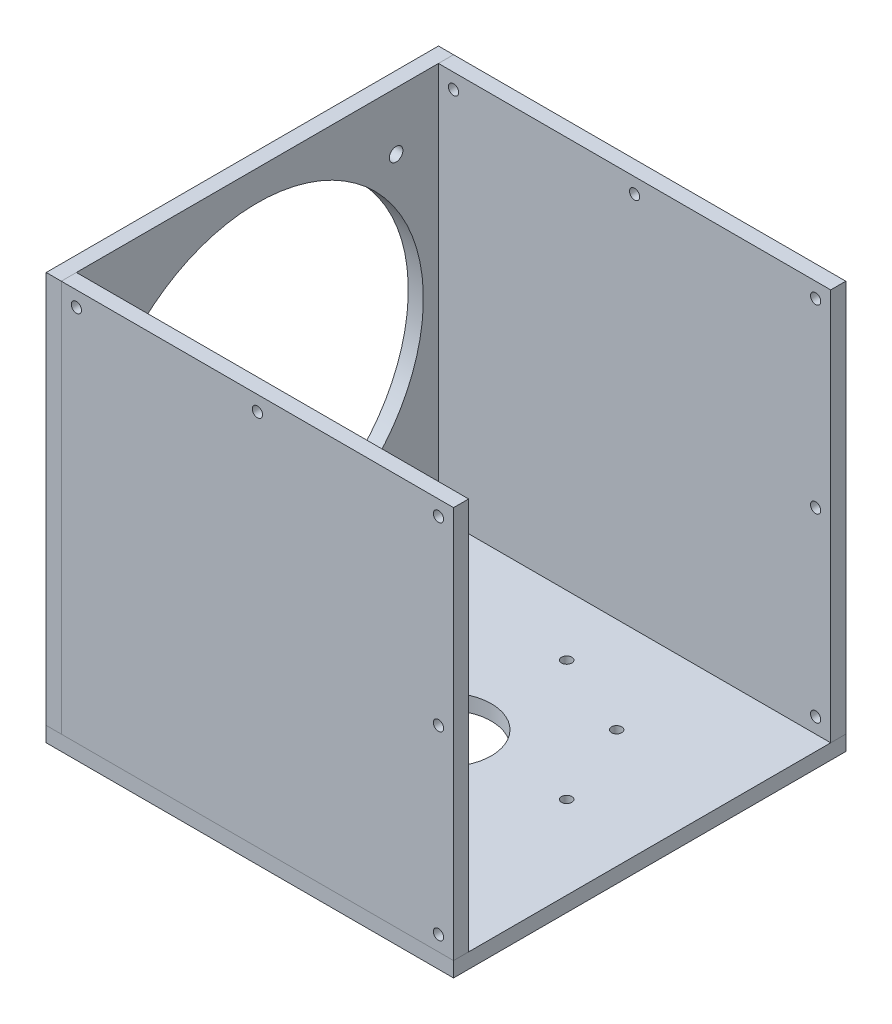
from build123d import *

# Parameters (mm, degrees)
CROQUIS1_R                            = 15
SALIENTE_EXTRUIR1_DEPTH               = 2.5
TALADRO_DE_MARGEN_PARA_M31_D          = 3.4
TALADRO_DE_MARGEN_PARA_M31_DEPTH      = 20
TALADRO_DE_MARGEN_PARA_M31_TIP        = 1.021463052
CROQUIS5_W                            = 130
CROQUIS5_H                            = 130
CROQUIS5_R                            = 55
SALIENTE_EXTRUIR2_DEPTH               = 5
TALADRO_DE_MARGEN_PARA_M41_AT_2_COUNT = 2
TALADRO_DE_MARGEN_PARA_M41_AT_2_PITCH = 130
TALADRO_DE_MARGEN_PARA_M41_AT_3_COUNT = 2
TALADRO_DE_MARGEN_PARA_M41_AT_3_PITCH = 91.923881554
TALADRO_DE_MARGEN_PARA_M41_AT_4_COUNT = 2
TALADRO_DE_MARGEN_PARA_M41_AT_4_PITCH = 91.923881554
CROQUIS9_W                            = 130
CROQUIS9_H                            = 130
SALIENTE_EXTRUIR4_DEPTH               = 5
TALADRO_START                         = 60
TALADRO_DE_MARGEN_PARA_M32_OUTLINE_R  = 1.7
TALADRO_DE_MARGEN_PARA_M32_DEPTH      = 5
MATRIZL2_COUNT                        = 2
MATRIZL2_PITCH                        = 125
TALADRO_START_2                       = -65
TALADRO_DE_MARGEN_PARA_M33_OUTLINE_R  = 1.7
TALADRO_DE_MARGEN_PARA_M33_DEPTH      = 5


# Read off the part's stored shape, not the designer's step: Taladro de margen para M32, Taladro de margen para M33
with BuildPart() as part:
    # Croquis1 → Saliente-Extruir1 (new, symmetric)
    with BuildSketch(Plane(origin=(0, 0, 0), x_dir=(1, 0, 0), z_dir=(0, 1, 0))):
        Polygon((0, 65), (-67.5, 65), (-67.5, -65), (0, -65), (67.5, -65), (67.5, 65), align=None)
        with Locations(Location((0, 0, 0), (0, 0, 270))):
            Circle(CROQUIS1_R, mode=Mode.SUBTRACT)
    extrude(amount=SALIENTE_EXTRUIR1_DEPTH, both=True)

    # Taladro de margen para M31
    with Locations(Plane(origin=(0, 2.5, 0), x_dir=(1, 0, 0), z_dir=(0, 1, 0))):
        with Locations((0, 40), (28.284271247, 28.284271247), (40, 0), (28.284271247, -28.284271247), (0, -40), (-28.284271247, -28.284271247), (-40, 0), (-28.284271247, 28.284271247)):
            Hole(TALADRO_DE_MARGEN_PARA_M31_D / 2, depth=TALADRO_DE_MARGEN_PARA_M31_DEPTH)
            with Locations((0, 0, -(TALADRO_DE_MARGEN_PARA_M31_DEPTH + TALADRO_DE_MARGEN_PARA_M31_TIP / 2))):  # 118° drill point
                Cone(0, TALADRO_DE_MARGEN_PARA_M31_D / 2, TALADRO_DE_MARGEN_PARA_M31_TIP, mode=Mode.SUBTRACT)


with BuildPart() as body_2:
    # Croquis5 → Saliente-Extruir2 (new body)
    with BuildSketch(Plane.ZY.offset(67.5)):
        with Locations((0, 67.5)):
            Rectangle(CROQUIS5_W, CROQUIS5_H)
        with Locations((0, 67.5)):
            Circle(CROQUIS5_R, mode=Mode.SUBTRACT)
    extrude(amount=-SALIENTE_EXTRUIR2_DEPTH)

    # Croquis7 → Taladro de margen para M41 (revolve, cut)
    with BuildSketch(Plane(origin=(-67.5, 113.461940777, 45.961940777), x_dir=(0, 0, 1), z_dir=(0, 1, 0))):
        Polygon((0, 0), (0, 21.351936393), (2.25, 20), (2.25, 0), align=None)
    taladro_de_margen_para_m41 = revolve(axis=Axis((-73.85, 113.461940777, 45.961940777), (1, 0, 0)), mode=Mode.SUBTRACT)

    # Taladro de margen para M41 at 2: Taladro de margen para M41 ×2
    with Locations(*[Vector(0, -0.7071067811865476, -0.7071067811865476) * (i * TALADRO_DE_MARGEN_PARA_M41_AT_2_PITCH) for i in range(1, TALADRO_DE_MARGEN_PARA_M41_AT_2_COUNT)]):
        add(taladro_de_margen_para_m41, mode=Mode.SUBTRACT)

    # Taladro de margen para M41 at 3: Taladro de margen para M41 ×2
    with Locations(*[(0, 0, -i * TALADRO_DE_MARGEN_PARA_M41_AT_3_PITCH) for i in range(1, TALADRO_DE_MARGEN_PARA_M41_AT_3_COUNT)]):
        add(taladro_de_margen_para_m41, mode=Mode.SUBTRACT)

    # Taladro de margen para M41 at 4: Taladro de margen para M41 ×2
    with Locations(*[(0, -i * TALADRO_DE_MARGEN_PARA_M41_AT_4_PITCH, 0) for i in range(1, TALADRO_DE_MARGEN_PARA_M41_AT_4_COUNT)]):
        add(taladro_de_margen_para_m41, mode=Mode.SUBTRACT)


with BuildPart() as body_3:
    # Croquis9 → Saliente-Extruir4 (new body)
    with BuildSketch(Plane.XY.offset(65)):
        with Locations((2.5, 67.5)):
            Rectangle(CROQUIS9_W, CROQUIS9_H)
    saliente_extruir4 = extrude(amount=-SALIENTE_EXTRUIR4_DEPTH)

    # Taladro de margen para M32 outline → Taladro de margen para M32 (cut)
    with BuildSketch(Plane.XY.offset(TALADRO_START)):
        with Locations((62.5, 7.5)):
            Circle(TALADRO_DE_MARGEN_PARA_M32_OUTLINE_R)
        with Locations((62.5, 67.5)):
            Circle(TALADRO_DE_MARGEN_PARA_M32_OUTLINE_R)
        with Locations((62.5, 127.5)):
            Circle(TALADRO_DE_MARGEN_PARA_M32_OUTLINE_R)
        with Locations((2.5, 127.5)):
            Circle(TALADRO_DE_MARGEN_PARA_M32_OUTLINE_R)
        with Locations((-57.5, 127.5)):
            Circle(TALADRO_DE_MARGEN_PARA_M32_OUTLINE_R)
    extrude(amount=TALADRO_DE_MARGEN_PARA_M32_DEPTH, mode=Mode.SUBTRACT)


with BuildPart() as matrizl2_1:
    # MatrizL2: Saliente-Extruir4 ×2
    with Locations(*[(0, 0, -i * MATRIZL2_PITCH) for i in range(1, MATRIZL2_COUNT)]):
        add(saliente_extruir4)

    # Taladro de margen para M33 outline → Taladro de margen para M33 (cut)
    with BuildSketch(Plane.XY.offset(TALADRO_START_2)):
        with Locations((62.5, 67.5)):
            Circle(TALADRO_DE_MARGEN_PARA_M33_OUTLINE_R)
        with Locations((62.5, 7.5)):
            Circle(TALADRO_DE_MARGEN_PARA_M33_OUTLINE_R)
        with Locations((2.5, 127.5)):
            Circle(TALADRO_DE_MARGEN_PARA_M33_OUTLINE_R)
        with Locations((-57.5, 127.5)):
            Circle(TALADRO_DE_MARGEN_PARA_M33_OUTLINE_R)
        with Locations((62.5, 127.5)):
            Circle(TALADRO_DE_MARGEN_PARA_M33_OUTLINE_R)
    extrude(amount=TALADRO_DE_MARGEN_PARA_M33_DEPTH, mode=Mode.SUBTRACT)


solid = Compound([part.part, body_2.part, body_3.part, matrizl2_1.part])
